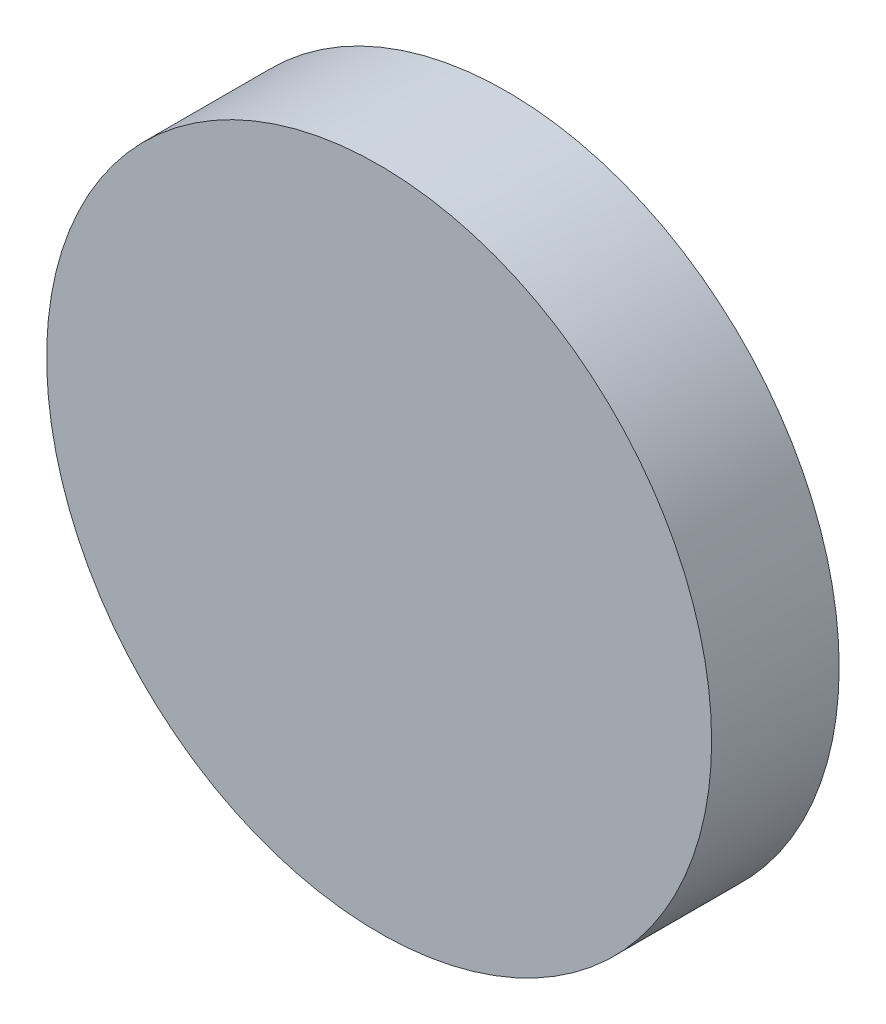
from build123d import *


with BuildPart() as part:
    # Sketch1 → Revolve1 (revolve)
    with BuildSketch(Plane(origin=(0, 0, 0), x_dir=(0, 0, -1), z_dir=(1, 0, 0))):
        Polygon((-2.596952363, 0), (-2.596952363, 101), (36.145188338, 101), (36.145188338, 98), (1.145188338, 98), (1.145188338, 83), (36.145188338, 83), (36.145188338, 80), (29.483104668, 80), (29.483104668, 81.257390859), (25.372970882, 81.257390859), (25.372970882, 80), (0.403047637, 80), (0.403047637, 0), align=None)
    revolve(axis=Axis((0, 0, 53.835453831), (0, 0, -1)))


solid = part.part
